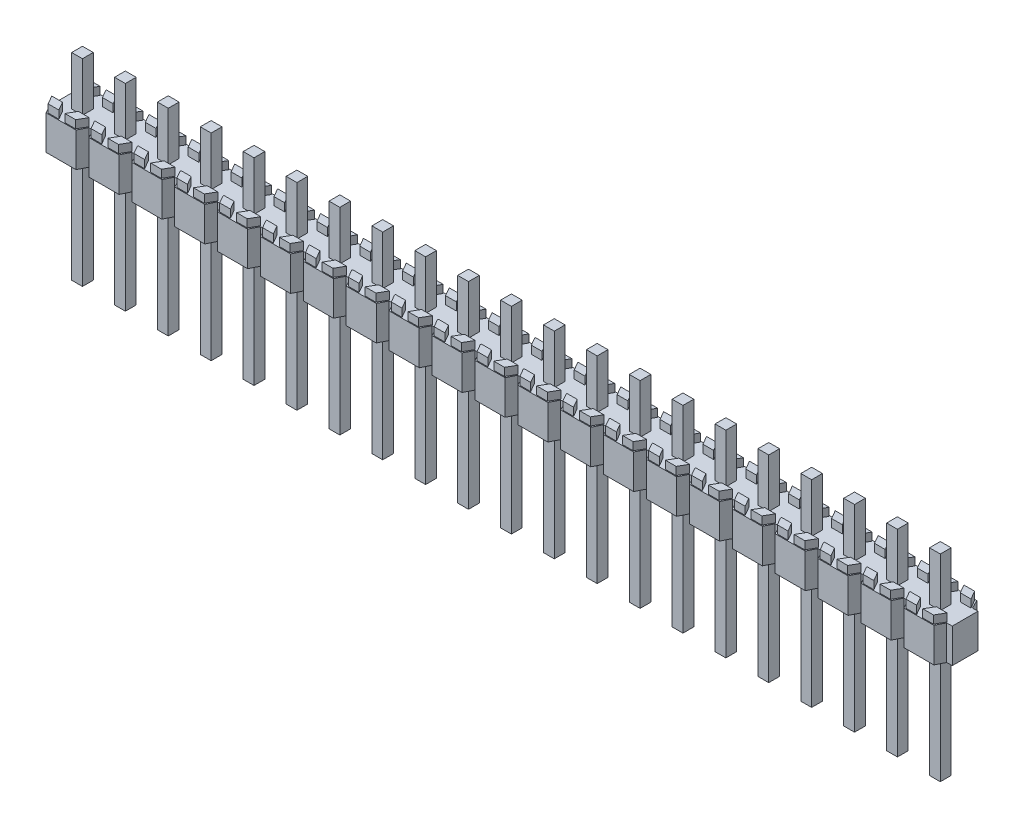
from build123d import *

# Parameters (mm, degrees)
BOSS_EXTRUDE1_DEPTH      = 1.48
BOSS_EXTRUDE1_DEPTH_BACK = 1.02
SKETCH1_W                = 0.64
SKETCH1_H                = 0.64
CUT_EXTRUDE2_DEPTH       = 0.47
SKETCH3_W                = 0.64
SKETCH3_H                = 0.64
BOSS_EXTRUDE2_DEPTH      = 2.9
SKETCH4_W                = 0.64
SKETCH4_H                = 0.64
BOSS_EXTRUDE3_DEPTH      = 6.75
LPATTERN1_START          = -1.02
LPATTERN1_OUTLINE_W      = 0.64
LPATTERN1_OUTLINE_H      = 0.64
LPATTERN1_DEPTH          = 2.03
LPATTERN1_START_2        = -7.77
LPATTERN1_2_OUTLINE_W    = 0.64
LPATTERN1_2_OUTLINE_H    = 0.64
LPATTERN1_2_DEPTH        = 6.75
LPATTERN1_START_3        = 1.01
LPATTERN1_3_OUTLINE_W    = 0.64
LPATTERN1_3_OUTLINE_H    = 0.64
LPATTERN1_3_DEPTH        = 2.9
LPATTERN1_4_DEPTH        = 0.47


# Read off the part's stored shape, not the designer's step: LPattern1
with BuildPart() as part:
    # Sketch1 → Boss-Extrude1 (new, two sides: drawn at the far end of the back side and taken through both)
    with BuildSketch(Plane(origin=(0, 0, 0), x_dir=(1, 0, 0), z_dir=(0, 1, 0)).offset(-BOSS_EXTRUDE1_DEPTH_BACK)):
        Polygon((-1.143, 0.762), (-0.889, 1.27), (0.889, 1.27), (1.143, 0.762), (1.47, 0.762), (1.47, -0.762), (1.143, -0.762), (0.889, -1.27), (-0.889, -1.27), (-1.143, -0.762), align=None)
        Rectangle(SKETCH1_W, SKETCH1_H, mode=Mode.SUBTRACT)
    extrude(amount=BOSS_EXTRUDE1_DEPTH + BOSS_EXTRUDE1_DEPTH_BACK)

    # Sketch2 → Cut-Extrude2 (cut)
    with BuildSketch(Plane(origin=(0, 1.48, 0), x_dir=(1, 0, 0), z_dir=(0, 1, 0))):
        Polygon((-1.143, 0.762), (-1.143, -0.762), (-0.889, -1.27), (0.889, -1.27), (1.143, -0.762), (1.47, -0.762), (1.47, 0.762), (1.143, 0.762), (0.889, 1.27), (-0.889, 1.27), align=None)
        Polygon((-1.106093937, -0.7112), (-0.471093937, -0.7112), (-0.1778, -1.2192), (-0.8128, -1.2192), align=None, mode=Mode.SUBTRACT)
        Polygon((-0.8128, 1.2192), (-1.106093937, 0.7112), (-0.471093937, 0.7112), (-0.1778, 1.2192), align=None, mode=Mode.SUBTRACT)
        Polygon((1.106093937, 0.7112), (0.471093937, 0.7112), (0.1778, 1.2192), (0.8128, 1.2192), align=None, mode=Mode.SUBTRACT)
        Polygon((0.8128, -1.2192), (1.106093937, -0.7112), (0.471093937, -0.7112), (0.1778, -1.2192), align=None, mode=Mode.SUBTRACT)
    extrude(amount=-CUT_EXTRUDE2_DEPTH, mode=Mode.SUBTRACT)

    # LPattern1 outline → LPattern1 (add)
    with BuildSketch(Plane(origin=(0, 0, 0), x_dir=(1, 0, 0), z_dir=(0, 1, 0)).offset(LPATTERN1_START)):
        Polygon((3.429, 1.27), (1.651, 1.27), (1.397, 0.762), (1.47, 0.762), (1.47, -0.762), (1.397, -0.762), (1.651, -1.27), (3.429, -1.27), (3.683, -0.762), (3.937, -0.762), (4.191, -1.27), (5.969, -1.27), (6.223, -0.762), (6.477, -0.762), (6.731, -1.27), (8.509, -1.27), (8.763, -0.762), (9.017, -0.762), (9.271, -1.27), (11.049, -1.27), (11.303, -0.762), (11.557, -0.762), (11.811, -1.27), (13.589, -1.27), (13.843, -0.762), (14.097, -0.762), (14.351, -1.27), (16.129, -1.27), (16.383, -0.762), (16.637, -0.762), (16.891, -1.27), (18.669, -1.27), (18.923, -0.762), (19.177, -0.762), (19.431, -1.27), (21.209, -1.27), (21.463, -0.762), (21.717, -0.762), (21.971, -1.27), (23.749, -1.27), (24.003, -0.762), (24.257, -0.762), (24.511, -1.27), (26.289, -1.27), (26.543, -0.762), (26.797, -0.762), (27.051, -1.27), (28.829, -1.27), (29.083, -0.762), (29.337, -0.762), (29.591, -1.27), (31.369, -1.27), (31.623, -0.762), (31.877, -0.762), (32.131, -1.27), (33.909, -1.27), (34.163, -0.762), (34.417, -0.762), (34.671, -1.27), (36.449, -1.27), (36.703, -0.762), (36.957, -0.762), (37.211, -1.27), (38.989, -1.27), (39.243, -0.762), (39.497, -0.762), (39.751, -1.27), (41.529, -1.27), (41.783, -0.762), (42.037, -0.762), (42.291, -1.27), (44.069, -1.27), (44.323, -0.762), (44.577, -0.762), (44.831, -1.27), (46.609, -1.27), (46.863, -0.762), (47.117, -0.762), (47.371, -1.27), (49.149, -1.27), (49.403, -0.762), (49.657, -0.762), (49.911, -1.27), (51.689, -1.27), (51.943, -0.762), (52.27, -0.762), (52.27, 0.762), (51.943, 0.762), (51.689, 1.27), (49.911, 1.27), (49.657, 0.762), (49.403, 0.762), (49.149, 1.27), (47.371, 1.27), (47.117, 0.762), (46.863, 0.762), (46.609, 1.27), (44.831, 1.27), (44.577, 0.762), (44.323, 0.762), (44.069, 1.27), (42.291, 1.27), (42.037, 0.762), (41.783, 0.762), (41.529, 1.27), (39.751, 1.27), (39.497, 0.762), (39.243, 0.762), (38.989, 1.27), (37.211, 1.27), (36.957, 0.762), (36.703, 0.762), (36.449, 1.27), (34.671, 1.27), (34.417, 0.762), (34.163, 0.762), (33.909, 1.27), (32.131, 1.27), (31.877, 0.762), (31.623, 0.762), (31.369, 1.27), (29.591, 1.27), (29.337, 0.762), (29.083, 0.762), (28.829, 1.27), (27.051, 1.27), (26.797, 0.762), (26.543, 0.762), (26.289, 1.27), (24.511, 1.27), (24.257, 0.762), (24.003, 0.762), (23.749, 1.27), (21.971, 1.27), (21.717, 0.762), (21.463, 0.762), (21.209, 1.27), (19.431, 1.27), (19.177, 0.762), (18.923, 0.762), (18.669, 1.27), (16.891, 1.27), (16.637, 0.762), (16.383, 0.762), (16.129, 1.27), (14.351, 1.27), (14.097, 0.762), (13.843, 0.762), (13.589, 1.27), (11.811, 1.27), (11.557, 0.762), (11.303, 0.762), (11.049, 1.27), (9.271, 1.27), (9.017, 0.762), (8.763, 0.762), (8.509, 1.27), (6.731, 1.27), (6.477, 0.762), (6.223, 0.762), (5.969, 1.27), (4.191, 1.27), (3.937, 0.762), (3.683, 0.762), align=None)
        with Locations((2.54, 0)):
            Rectangle(LPATTERN1_OUTLINE_W, LPATTERN1_OUTLINE_H, mode=Mode.SUBTRACT)
        with Locations((5.08, 0)):
            Rectangle(LPATTERN1_OUTLINE_W, LPATTERN1_OUTLINE_H, mode=Mode.SUBTRACT)
        with Locations((7.62, 0)):
            Rectangle(LPATTERN1_OUTLINE_W, LPATTERN1_OUTLINE_H, mode=Mode.SUBTRACT)
        with Locations((10.16, 0)):
            Rectangle(LPATTERN1_OUTLINE_W, LPATTERN1_OUTLINE_H, mode=Mode.SUBTRACT)
        with Locations((12.7, 0)):
            Rectangle(LPATTERN1_OUTLINE_W, LPATTERN1_OUTLINE_H, mode=Mode.SUBTRACT)
        with Locations((15.24, 0)):
            Rectangle(LPATTERN1_OUTLINE_W, LPATTERN1_OUTLINE_H, mode=Mode.SUBTRACT)
        with Locations((17.78, 0)):
            Rectangle(LPATTERN1_OUTLINE_W, LPATTERN1_OUTLINE_H, mode=Mode.SUBTRACT)
        with Locations((20.32, 0)):
            Rectangle(LPATTERN1_OUTLINE_W, LPATTERN1_OUTLINE_H, mode=Mode.SUBTRACT)
        with Locations((22.86, 0)):
            Rectangle(LPATTERN1_OUTLINE_W, LPATTERN1_OUTLINE_H, mode=Mode.SUBTRACT)
        with Locations((25.4, 0)):
            Rectangle(LPATTERN1_OUTLINE_W, LPATTERN1_OUTLINE_H, mode=Mode.SUBTRACT)
        with Locations((27.94, 0)):
            Rectangle(LPATTERN1_OUTLINE_W, LPATTERN1_OUTLINE_H, mode=Mode.SUBTRACT)
        with Locations((30.48, 0)):
            Rectangle(LPATTERN1_OUTLINE_W, LPATTERN1_OUTLINE_H, mode=Mode.SUBTRACT)
        with Locations((33.02, 0)):
            Rectangle(LPATTERN1_OUTLINE_W, LPATTERN1_OUTLINE_H, mode=Mode.SUBTRACT)
        with Locations((35.56, 0)):
            Rectangle(LPATTERN1_OUTLINE_W, LPATTERN1_OUTLINE_H, mode=Mode.SUBTRACT)
        with Locations((38.1, 0)):
            Rectangle(LPATTERN1_OUTLINE_W, LPATTERN1_OUTLINE_H, mode=Mode.SUBTRACT)
        with Locations((40.64, 0)):
            Rectangle(LPATTERN1_OUTLINE_W, LPATTERN1_OUTLINE_H, mode=Mode.SUBTRACT)
        with Locations((43.18, 0)):
            Rectangle(LPATTERN1_OUTLINE_W, LPATTERN1_OUTLINE_H, mode=Mode.SUBTRACT)
        with Locations((45.72, 0)):
            Rectangle(LPATTERN1_OUTLINE_W, LPATTERN1_OUTLINE_H, mode=Mode.SUBTRACT)
        with Locations((48.26, 0)):
            Rectangle(LPATTERN1_OUTLINE_W, LPATTERN1_OUTLINE_H, mode=Mode.SUBTRACT)
        with Locations((50.8, 0)):
            Rectangle(LPATTERN1_OUTLINE_W, LPATTERN1_OUTLINE_H, mode=Mode.SUBTRACT)
    extrude(amount=LPATTERN1_DEPTH)

    # LPattern1 2 outline → LPattern1 2 (add)
    with BuildSketch(Plane(origin=(0, 0, 0), x_dir=(1, 0, 0), z_dir=(0, 1, 0)).offset(LPATTERN1_START_2)):
        with Locations((50.8, 0)):
            Rectangle(LPATTERN1_2_OUTLINE_W, LPATTERN1_2_OUTLINE_H)
        with Locations((48.26, 0)):
            Rectangle(LPATTERN1_2_OUTLINE_W, LPATTERN1_2_OUTLINE_H)
        with Locations((45.72, 0)):
            Rectangle(LPATTERN1_2_OUTLINE_W, LPATTERN1_2_OUTLINE_H)
        with Locations((43.18, 0)):
            Rectangle(LPATTERN1_2_OUTLINE_W, LPATTERN1_2_OUTLINE_H)
        with Locations((40.64, 0)):
            Rectangle(LPATTERN1_2_OUTLINE_W, LPATTERN1_2_OUTLINE_H)
        with Locations((38.1, 0)):
            Rectangle(LPATTERN1_2_OUTLINE_W, LPATTERN1_2_OUTLINE_H)
        with Locations((35.56, 0)):
            Rectangle(LPATTERN1_2_OUTLINE_W, LPATTERN1_2_OUTLINE_H)
        with Locations((33.02, 0)):
            Rectangle(LPATTERN1_2_OUTLINE_W, LPATTERN1_2_OUTLINE_H)
        with Locations((30.48, 0)):
            Rectangle(LPATTERN1_2_OUTLINE_W, LPATTERN1_2_OUTLINE_H)
        with Locations((27.94, 0)):
            Rectangle(LPATTERN1_2_OUTLINE_W, LPATTERN1_2_OUTLINE_H)
        with Locations((25.4, 0)):
            Rectangle(LPATTERN1_2_OUTLINE_W, LPATTERN1_2_OUTLINE_H)
        with Locations((22.86, 0)):
            Rectangle(LPATTERN1_2_OUTLINE_W, LPATTERN1_2_OUTLINE_H)
        with Locations((20.32, 0)):
            Rectangle(LPATTERN1_2_OUTLINE_W, LPATTERN1_2_OUTLINE_H)
        with Locations((17.78, 0)):
            Rectangle(LPATTERN1_2_OUTLINE_W, LPATTERN1_2_OUTLINE_H)
        with Locations((15.24, 0)):
            Rectangle(LPATTERN1_2_OUTLINE_W, LPATTERN1_2_OUTLINE_H)
        with Locations((12.7, 0)):
            Rectangle(LPATTERN1_2_OUTLINE_W, LPATTERN1_2_OUTLINE_H)
        with Locations((10.16, 0)):
            Rectangle(LPATTERN1_2_OUTLINE_W, LPATTERN1_2_OUTLINE_H)
        with Locations((7.62, 0)):
            Rectangle(LPATTERN1_2_OUTLINE_W, LPATTERN1_2_OUTLINE_H)
        with Locations((5.08, 0)):
            Rectangle(LPATTERN1_2_OUTLINE_W, LPATTERN1_2_OUTLINE_H)
        with Locations((2.54, 0)):
            Rectangle(LPATTERN1_2_OUTLINE_W, LPATTERN1_2_OUTLINE_H)
    extrude(amount=LPATTERN1_2_DEPTH)

    # LPattern1 3 outline → LPattern1 3 (add)
    with BuildSketch(Plane(origin=(0, 0, 0), x_dir=(1, 0, 0), z_dir=(0, 1, 0)).offset(LPATTERN1_START_3)):
        with Locations((50.8, 0)):
            Rectangle(LPATTERN1_3_OUTLINE_W, LPATTERN1_3_OUTLINE_H)
        with Locations((48.26, 0)):
            Rectangle(LPATTERN1_3_OUTLINE_W, LPATTERN1_3_OUTLINE_H)
        with Locations((45.72, 0)):
            Rectangle(LPATTERN1_3_OUTLINE_W, LPATTERN1_3_OUTLINE_H)
        with Locations((43.18, 0)):
            Rectangle(LPATTERN1_3_OUTLINE_W, LPATTERN1_3_OUTLINE_H)
        with Locations((40.64, 0)):
            Rectangle(LPATTERN1_3_OUTLINE_W, LPATTERN1_3_OUTLINE_H)
        with Locations((38.1, 0)):
            Rectangle(LPATTERN1_3_OUTLINE_W, LPATTERN1_3_OUTLINE_H)
        with Locations((35.56, 0)):
            Rectangle(LPATTERN1_3_OUTLINE_W, LPATTERN1_3_OUTLINE_H)
        with Locations((33.02, 0)):
            Rectangle(LPATTERN1_3_OUTLINE_W, LPATTERN1_3_OUTLINE_H)
        with Locations((30.48, 0)):
            Rectangle(LPATTERN1_3_OUTLINE_W, LPATTERN1_3_OUTLINE_H)
        with Locations((27.94, 0)):
            Rectangle(LPATTERN1_3_OUTLINE_W, LPATTERN1_3_OUTLINE_H)
        with Locations((25.4, 0)):
            Rectangle(LPATTERN1_3_OUTLINE_W, LPATTERN1_3_OUTLINE_H)
        with Locations((22.86, 0)):
            Rectangle(LPATTERN1_3_OUTLINE_W, LPATTERN1_3_OUTLINE_H)
        with Locations((20.32, 0)):
            Rectangle(LPATTERN1_3_OUTLINE_W, LPATTERN1_3_OUTLINE_H)
        with Locations((17.78, 0)):
            Rectangle(LPATTERN1_3_OUTLINE_W, LPATTERN1_3_OUTLINE_H)
        with Locations((15.24, 0)):
            Rectangle(LPATTERN1_3_OUTLINE_W, LPATTERN1_3_OUTLINE_H)
        with Locations((12.7, 0)):
            Rectangle(LPATTERN1_3_OUTLINE_W, LPATTERN1_3_OUTLINE_H)
        with Locations((10.16, 0)):
            Rectangle(LPATTERN1_3_OUTLINE_W, LPATTERN1_3_OUTLINE_H)
        with Locations((7.62, 0)):
            Rectangle(LPATTERN1_3_OUTLINE_W, LPATTERN1_3_OUTLINE_H)
        with Locations((5.08, 0)):
            Rectangle(LPATTERN1_3_OUTLINE_W, LPATTERN1_3_OUTLINE_H)
        with Locations((2.54, 0)):
            Rectangle(LPATTERN1_3_OUTLINE_W, LPATTERN1_3_OUTLINE_H)
    extrude(amount=LPATTERN1_3_DEPTH)

    # LPattern1 4 outline → LPattern1 4 (add)
    with BuildSketch(Plane(origin=(0, 0, 0), x_dir=(1, 0, 0), z_dir=(0, 1, 0)).offset(LPATTERN1_START_3)):
        Polygon((1.433906063, 0.7112), (2.068906063, 0.7112), (2.3622, 1.2192), (1.7272, 1.2192), align=None)
        Polygon((1.433906063, -0.7112), (1.7272, -1.2192), (2.3622, -1.2192), (2.068906063, -0.7112), align=None)
        Polygon((3.3528, -1.2192), (3.646093937, -0.7112), (3.011093937, -0.7112), (2.7178, -1.2192), align=None)
        Polygon((4.9022, -1.2192), (4.608906063, -0.7112), (4.01, -0.7112), (4.01, -0.762), (4.003235457, -0.762), (4.2672, -1.2192), align=None)
        Polygon((5.8928, -1.2192), (6.186093937, -0.7112), (5.551093937, -0.7112), (5.2578, -1.2192), align=None)
        Polygon((7.4422, -1.2192), (7.148906063, -0.7112), (6.55, -0.7112), (6.55, -0.762), (6.543235457, -0.762), (6.8072, -1.2192), align=None)
        Polygon((8.4328, -1.2192), (8.726093937, -0.7112), (8.091093937, -0.7112), (7.7978, -1.2192), align=None)
        Polygon((9.9822, -1.2192), (9.688906063, -0.7112), (9.09, -0.7112), (9.09, -0.762), (9.083235457, -0.762), (9.3472, -1.2192), align=None)
        Polygon((10.9728, -1.2192), (11.266093937, -0.7112), (10.631093937, -0.7112), (10.3378, -1.2192), align=None)
        Polygon((12.5222, -1.2192), (12.228906063, -0.7112), (11.63, -0.7112), (11.63, -0.762), (11.623235457, -0.762), (11.8872, -1.2192), align=None)
        Polygon((13.5128, -1.2192), (13.806093937, -0.7112), (13.171093937, -0.7112), (12.8778, -1.2192), align=None)
        Polygon((15.0622, -1.2192), (14.768906063, -0.7112), (14.17, -0.7112), (14.17, -0.762), (14.163235457, -0.762), (14.4272, -1.2192), align=None)
        Polygon((16.0528, -1.2192), (16.346093937, -0.7112), (15.711093937, -0.7112), (15.4178, -1.2192), align=None)
        Polygon((17.6022, -1.2192), (17.308906063, -0.7112), (16.71, -0.7112), (16.71, -0.762), (16.703235457, -0.762), (16.9672, -1.2192), align=None)
        Polygon((18.5928, -1.2192), (18.886093937, -0.7112), (18.251093937, -0.7112), (17.9578, -1.2192), align=None)
        Polygon((20.1422, -1.2192), (19.848906063, -0.7112), (19.25, -0.7112), (19.25, -0.762), (19.243235457, -0.762), (19.5072, -1.2192), align=None)
        Polygon((21.1328, -1.2192), (21.426093937, -0.7112), (20.791093937, -0.7112), (20.4978, -1.2192), align=None)
        Polygon((22.6822, -1.2192), (22.388906063, -0.7112), (21.79, -0.7112), (21.79, -0.762), (21.783235457, -0.762), (22.0472, -1.2192), align=None)
        Polygon((23.6728, -1.2192), (23.966093937, -0.7112), (23.331093937, -0.7112), (23.0378, -1.2192), align=None)
        Polygon((25.2222, -1.2192), (24.928906063, -0.7112), (24.33, -0.7112), (24.33, -0.762), (24.323235457, -0.762), (24.5872, -1.2192), align=None)
        Polygon((26.2128, -1.2192), (26.506093937, -0.7112), (25.871093937, -0.7112), (25.5778, -1.2192), align=None)
        Polygon((27.7622, -1.2192), (27.468906063, -0.7112), (26.87, -0.7112), (26.87, -0.762), (26.863235457, -0.762), (27.1272, -1.2192), align=None)
        Polygon((28.7528, -1.2192), (29.046093937, -0.7112), (28.411093937, -0.7112), (28.1178, -1.2192), align=None)
        Polygon((30.3022, -1.2192), (30.008906063, -0.7112), (29.41, -0.7112), (29.41, -0.762), (29.403235457, -0.762), (29.6672, -1.2192), align=None)
        Polygon((31.2928, -1.2192), (31.586093937, -0.7112), (30.951093937, -0.7112), (30.6578, -1.2192), align=None)
        Polygon((32.8422, -1.2192), (32.548906063, -0.7112), (31.95, -0.7112), (31.95, -0.762), (31.943235457, -0.762), (32.2072, -1.2192), align=None)
        Polygon((33.8328, -1.2192), (34.126093937, -0.7112), (33.491093937, -0.7112), (33.1978, -1.2192), align=None)
        Polygon((35.3822, -1.2192), (35.088906063, -0.7112), (34.49, -0.7112), (34.49, -0.762), (34.483235457, -0.762), (34.7472, -1.2192), align=None)
        Polygon((36.3728, -1.2192), (36.666093937, -0.7112), (36.031093937, -0.7112), (35.7378, -1.2192), align=None)
        Polygon((37.9222, -1.2192), (37.628906063, -0.7112), (37.03, -0.7112), (37.03, -0.762), (37.023235457, -0.762), (37.2872, -1.2192), align=None)
        Polygon((38.9128, -1.2192), (39.206093937, -0.7112), (38.571093937, -0.7112), (38.2778, -1.2192), align=None)
        Polygon((40.4622, -1.2192), (40.168906063, -0.7112), (39.57, -0.7112), (39.57, -0.762), (39.563235457, -0.762), (39.8272, -1.2192), align=None)
        Polygon((41.4528, -1.2192), (41.746093937, -0.7112), (41.111093937, -0.7112), (40.8178, -1.2192), align=None)
        Polygon((43.0022, -1.2192), (42.708906063, -0.7112), (42.11, -0.7112), (42.11, -0.762), (42.103235457, -0.762), (42.3672, -1.2192), align=None)
        Polygon((43.9928, -1.2192), (44.286093937, -0.7112), (43.651093937, -0.7112), (43.3578, -1.2192), align=None)
        Polygon((45.5422, -1.2192), (45.248906063, -0.7112), (44.65, -0.7112), (44.65, -0.762), (44.643235457, -0.762), (44.9072, -1.2192), align=None)
        Polygon((46.5328, -1.2192), (46.826093937, -0.7112), (46.191093937, -0.7112), (45.8978, -1.2192), align=None)
        Polygon((48.0822, -1.2192), (47.788906063, -0.7112), (47.19, -0.7112), (47.19, -0.762), (47.183235457, -0.762), (47.4472, -1.2192), align=None)
        Polygon((49.0728, -1.2192), (49.366093937, -0.7112), (48.731093937, -0.7112), (48.4378, -1.2192), align=None)
        Polygon((50.6222, -1.2192), (50.328906063, -0.7112), (49.73, -0.7112), (49.73, -0.762), (49.723235457, -0.762), (49.9872, -1.2192), align=None)
        Polygon((51.6128, -1.2192), (51.906093937, -0.7112), (51.271093937, -0.7112), (50.9778, -1.2192), align=None)
        Polygon((3.646093937, 0.7112), (3.3528, 1.2192), (2.7178, 1.2192), (3.011093937, 0.7112), align=None)
        Polygon((4.608906063, 0.7112), (4.9022, 1.2192), (4.2672, 1.2192), (4.003235457, 0.762), (4.01, 0.762), (4.01, 0.7112), align=None)
        Polygon((6.186093937, 0.7112), (5.8928, 1.2192), (5.2578, 1.2192), (5.551093937, 0.7112), align=None)
        Polygon((7.148906063, 0.7112), (7.4422, 1.2192), (6.8072, 1.2192), (6.543235457, 0.762), (6.55, 0.762), (6.55, 0.7112), align=None)
        Polygon((8.726093937, 0.7112), (8.4328, 1.2192), (7.7978, 1.2192), (8.091093937, 0.7112), align=None)
        Polygon((9.688906063, 0.7112), (9.9822, 1.2192), (9.3472, 1.2192), (9.083235457, 0.762), (9.09, 0.762), (9.09, 0.7112), align=None)
        Polygon((11.266093937, 0.7112), (10.9728, 1.2192), (10.3378, 1.2192), (10.631093937, 0.7112), align=None)
        Polygon((12.228906063, 0.7112), (12.5222, 1.2192), (11.8872, 1.2192), (11.623235457, 0.762), (11.63, 0.762), (11.63, 0.7112), align=None)
        Polygon((13.806093937, 0.7112), (13.5128, 1.2192), (12.8778, 1.2192), (13.171093937, 0.7112), align=None)
        Polygon((14.768906063, 0.7112), (15.0622, 1.2192), (14.4272, 1.2192), (14.163235457, 0.762), (14.17, 0.762), (14.17, 0.7112), align=None)
        Polygon((16.346093937, 0.7112), (16.0528, 1.2192), (15.4178, 1.2192), (15.711093937, 0.7112), align=None)
        Polygon((17.308906063, 0.7112), (17.6022, 1.2192), (16.9672, 1.2192), (16.703235457, 0.762), (16.71, 0.762), (16.71, 0.7112), align=None)
        Polygon((18.886093937, 0.7112), (18.5928, 1.2192), (17.9578, 1.2192), (18.251093937, 0.7112), align=None)
        Polygon((19.848906063, 0.7112), (20.1422, 1.2192), (19.5072, 1.2192), (19.243235457, 0.762), (19.25, 0.762), (19.25, 0.7112), align=None)
        Polygon((21.426093937, 0.7112), (21.1328, 1.2192), (20.4978, 1.2192), (20.791093937, 0.7112), align=None)
        Polygon((22.388906063, 0.7112), (22.6822, 1.2192), (22.0472, 1.2192), (21.783235457, 0.762), (21.79, 0.762), (21.79, 0.7112), align=None)
        Polygon((23.966093937, 0.7112), (23.6728, 1.2192), (23.0378, 1.2192), (23.331093937, 0.7112), align=None)
        Polygon((24.928906063, 0.7112), (25.2222, 1.2192), (24.5872, 1.2192), (24.323235457, 0.762), (24.33, 0.762), (24.33, 0.7112), align=None)
        Polygon((26.506093937, 0.7112), (26.2128, 1.2192), (25.5778, 1.2192), (25.871093937, 0.7112), align=None)
        Polygon((27.468906063, 0.7112), (27.7622, 1.2192), (27.1272, 1.2192), (26.863235457, 0.762), (26.87, 0.762), (26.87, 0.7112), align=None)
        Polygon((29.046093937, 0.7112), (28.7528, 1.2192), (28.1178, 1.2192), (28.411093937, 0.7112), align=None)
        Polygon((30.008906063, 0.7112), (30.3022, 1.2192), (29.6672, 1.2192), (29.403235457, 0.762), (29.41, 0.762), (29.41, 0.7112), align=None)
        Polygon((31.586093937, 0.7112), (31.2928, 1.2192), (30.6578, 1.2192), (30.951093937, 0.7112), align=None)
        Polygon((32.548906063, 0.7112), (32.8422, 1.2192), (32.2072, 1.2192), (31.943235457, 0.762), (31.95, 0.762), (31.95, 0.7112), align=None)
        Polygon((34.126093937, 0.7112), (33.8328, 1.2192), (33.1978, 1.2192), (33.491093937, 0.7112), align=None)
        Polygon((35.088906063, 0.7112), (35.3822, 1.2192), (34.7472, 1.2192), (34.483235457, 0.762), (34.49, 0.762), (34.49, 0.7112), align=None)
        Polygon((36.666093937, 0.7112), (36.3728, 1.2192), (35.7378, 1.2192), (36.031093937, 0.7112), align=None)
        Polygon((37.628906063, 0.7112), (37.9222, 1.2192), (37.2872, 1.2192), (37.023235457, 0.762), (37.03, 0.762), (37.03, 0.7112), align=None)
        Polygon((39.206093937, 0.7112), (38.9128, 1.2192), (38.2778, 1.2192), (38.571093937, 0.7112), align=None)
        Polygon((40.168906063, 0.7112), (40.4622, 1.2192), (39.8272, 1.2192), (39.563235457, 0.762), (39.57, 0.762), (39.57, 0.7112), align=None)
        Polygon((41.746093937, 0.7112), (41.4528, 1.2192), (40.8178, 1.2192), (41.111093937, 0.7112), align=None)
        Polygon((42.708906063, 0.7112), (43.0022, 1.2192), (42.3672, 1.2192), (42.103235457, 0.762), (42.11, 0.762), (42.11, 0.7112), align=None)
        Polygon((44.286093937, 0.7112), (43.9928, 1.2192), (43.3578, 1.2192), (43.651093937, 0.7112), align=None)
        Polygon((45.248906063, 0.7112), (45.5422, 1.2192), (44.9072, 1.2192), (44.643235457, 0.762), (44.65, 0.762), (44.65, 0.7112), align=None)
        Polygon((46.826093937, 0.7112), (46.5328, 1.2192), (45.8978, 1.2192), (46.191093937, 0.7112), align=None)
        Polygon((47.788906063, 0.7112), (48.0822, 1.2192), (47.4472, 1.2192), (47.183235457, 0.762), (47.19, 0.762), (47.19, 0.7112), align=None)
        Polygon((49.366093937, 0.7112), (49.0728, 1.2192), (48.4378, 1.2192), (48.731093937, 0.7112), align=None)
        Polygon((50.328906063, 0.7112), (50.6222, 1.2192), (49.9872, 1.2192), (49.723235457, 0.762), (49.73, 0.762), (49.73, 0.7112), align=None)
        Polygon((51.906093937, 0.7112), (51.6128, 1.2192), (50.9778, 1.2192), (51.271093937, 0.7112), align=None)
    extrude(amount=LPATTERN1_4_DEPTH)


with BuildPart() as body_2:
    # Sketch3 → Boss-Extrude2 (new body)
    with BuildSketch(Plane(origin=(0, 1.01, 0), x_dir=(1, 0, 0), z_dir=(0, 1, 0))):
        Rectangle(SKETCH3_W, SKETCH3_H)
    extrude(amount=BOSS_EXTRUDE2_DEPTH)


with BuildPart() as body_3:
    # Sketch4 → Boss-Extrude3 (new body)
    with BuildSketch(Plane.XZ.offset(1.02)):
        Rectangle(SKETCH4_W, SKETCH4_H)
    extrude(amount=BOSS_EXTRUDE3_DEPTH)


solid = Compound([part.part, body_2.part, body_3.part])
